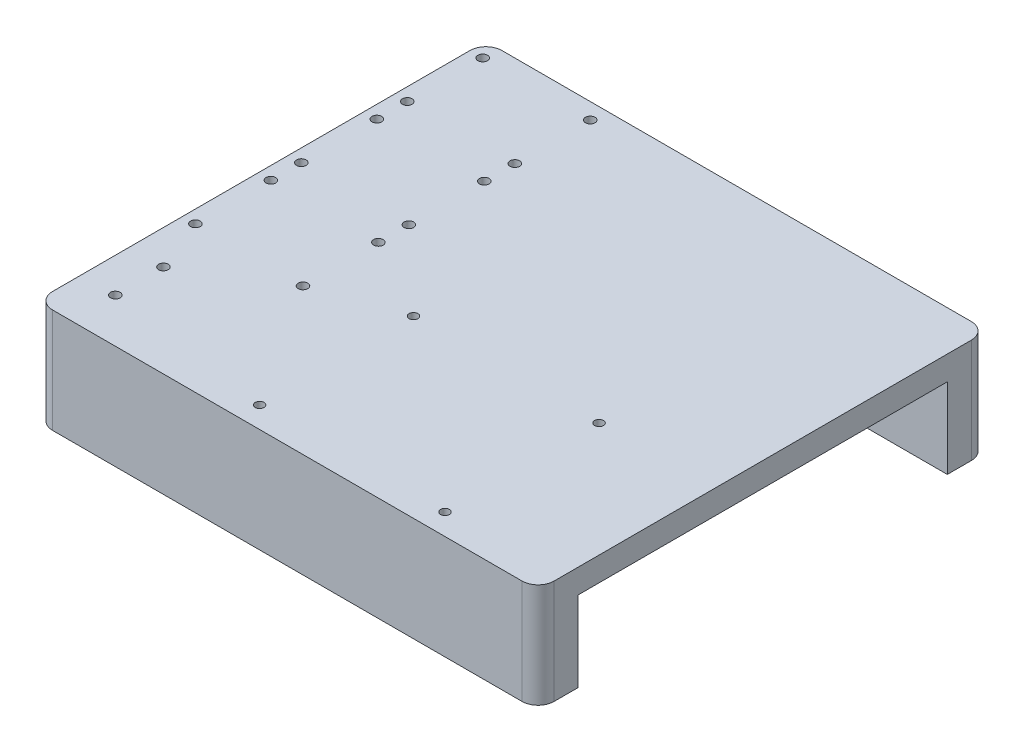
from build123d import *

# Parameters (mm, degrees)
BOSS_EXTRUDE1_DEPTH = 7.62
SKETCH5_W           = 158.75
SKETCH5_H           = 12.7
BOSS_EXTRUDE2_DEPTH = 25.4
FILLET1_R           = 5.08
SKETCH3_R           = 1.397
SKETCH3_R_2         = 1.524
CUT_EXTRUDE1_DEPTH  = 5.08


with BuildPart() as part:
    # Sketch1 → Boss-Extrude1 (new body)
    with BuildSketch(Plane(origin=(0, 0, 0), x_dir=(1, 0, 0), z_dir=(0, 1, 0))):
        Polygon((0, 0), (120.65, 0), (120.65, 142.24), (-38.1, 142.24), (-38.1, 0), align=None)
    extrude(amount=BOSS_EXTRUDE1_DEPTH)

    # Sketch5 → Boss-Extrude2 (add)
    with BuildSketch(Plane(origin=(0, 0, 0), x_dir=(-1, 0, 0), z_dir=(0, -1, 0))):
        with Locations((-41.275, 6.35)):
            Rectangle(SKETCH5_W, SKETCH5_H)
        with Locations((-41.275, 135.89)):
            Rectangle(SKETCH5_W, SKETCH5_H)
    extrude(amount=BOSS_EXTRUDE2_DEPTH)

    # Fillet1
    fillet1_edges = [part.edges().sort_by_distance(p)[0] for p in [
        (-38.1, -8.89, 0),
        (120.65, -8.89, 0),
        (120.65, -8.89, -142.24),
        (-38.1, -8.89, -142.24),
    ]]
    fillet(fillet1_edges, radius=FILLET1_R)

    # Sketch3 → Cut-Extrude1 (cut)
    with BuildSketch(Plane(origin=(0, 7.62, 0), x_dir=(1, 0, 0), z_dir=(0, 1, 0))):
        with Locations((25.781, 6.731)):
            Circle(SKETCH3_R)
        with Locations((25.781, 55.4355)):
            Circle(SKETCH3_R)
        with Locations((84.455, 55.499)):
            Circle(SKETCH3_R)
        with Locations((84.455, 6.731)):
            Circle(SKETCH3_R)
        with Locations((-34.036, 137.16)):
            Circle(SKETCH3_R_2)
        with Locations((0, 137.16)):
            Circle(SKETCH3_R_2)
        with Locations((-34.036, 113.284)):
            Circle(SKETCH3_R_2)
        with Locations((0, 113.284)):
            Circle(SKETCH3_R_2)
        with Locations((-34.036, 103.632)):
            Circle(SKETCH3_R_2)
        with Locations((0, 103.632)):
            Circle(SKETCH3_R_2)
        with Locations((-34.036, 79.756)):
            Circle(SKETCH3_R_2)
        with Locations((0, 79.756)):
            Circle(SKETCH3_R_2)
        with Locations((-34.036, 70.104)):
            Circle(SKETCH3_R_2)
        with Locations((0, 70.104)):
            Circle(SKETCH3_R_2)
        with Locations((-34.036, 46.228)):
            Circle(SKETCH3_R_2)
        with Locations((0, 46.228)):
            Circle(SKETCH3_R_2)
        with Locations((-27.178, 14.003291804)):
            Circle(SKETCH3_R_2)
        with Locations((-27.269651582, 29.334943362)):
            Circle(SKETCH3_R_2)
    extrude(amount=-CUT_EXTRUDE1_DEPTH, mode=Mode.SUBTRACT)


solid = part.part
